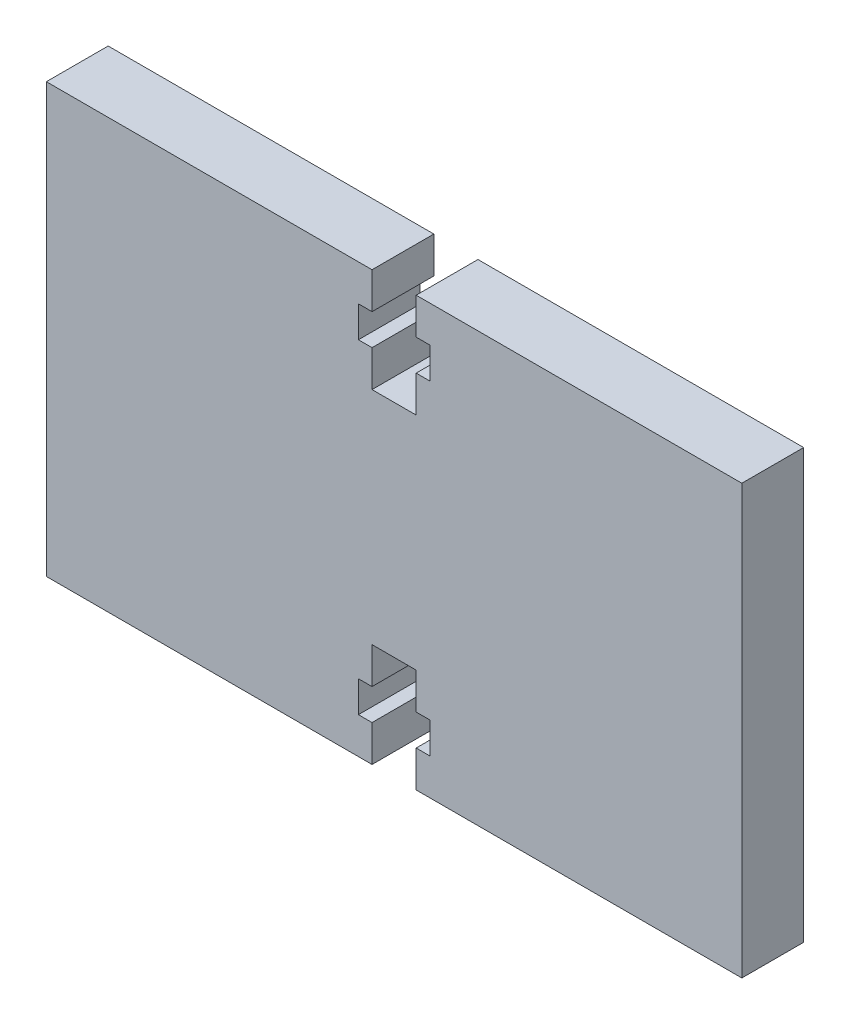
from build123d import *

# Parameters (mm, degrees)
BOSS_EXTRUDE1_DEPTH = 4.7625


with BuildPart() as part:
    # Sketch1 → Boss-Extrude1 (new body)
    with BuildSketch(Plane.XY):
        Polygon((1.7, -13.71), (1.7, -16.51), (26.797, -16.51), (26.797, 16.51), (1.7, 16.51), (1.7, 13.71), (2.75, 13.71), (2.75, 11.31), (1.7, 11.31), (1.7, 8.51), (-1.7, 8.51), (-1.7, 11.31), (-2.75, 11.31), (-2.75, 13.71), (-1.7, 13.71), (-1.7, 16.51), (-26.797, 16.51), (-26.797, -16.51), (-1.7, -16.51), (-1.7, -13.71), (-2.75, -13.71), (-2.75, -11.31), (-1.7, -11.31), (-1.7, -8.51), (1.7, -8.51), (1.7, -11.31), (2.75, -11.31), (2.75, -13.71), align=None)
    extrude(amount=BOSS_EXTRUDE1_DEPTH)


solid = part.part
